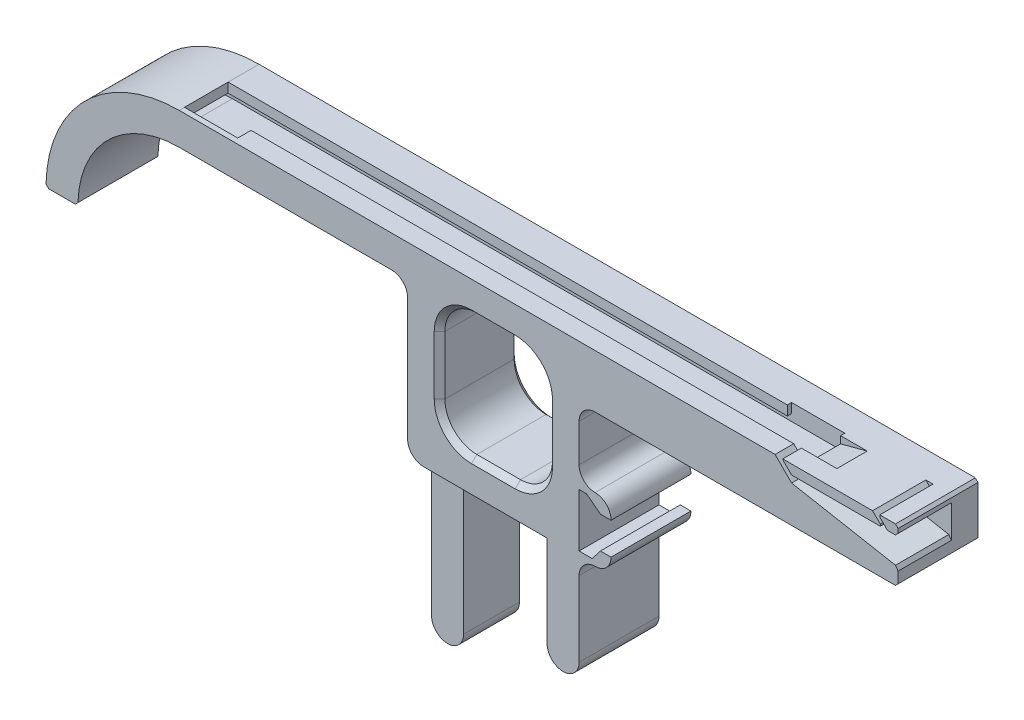
from build123d import *
from OCP.BRepFilletAPI import BRepFilletAPI_MakeChamfer

# Parameters (mm, degrees)
BOSS_EXTRUDE1_DEPTH = 15
BOSS_EXTRUDE2_DEPTH = 15
SKETCH6_W           = 115
SKETCH6_H           = 1.3
CUT_EXTRUDE2_DEPTH  = 10
CUT_EXTRUDE3_DEPTH  = 10
CUT_EXTRUDE4_DEPTH  = 10
BOSS_EXTRUDE3_DEPTH = 1
CUT_EXTRUDE5_REACH  = 117.913
SKETCH10_W          = 115
SKETCH10_H          = 5.7
SKETCH13_W          = 20.2
SKETCH13_H          = 23
CUT_EXTRUDE6_DEPTH  = 111.121977825
FILLET1_R           = 6
SKETCH14_W          = 6
SKETCH14_H          = 31
CUT_EXTRUDE7_DEPTH  = 4.5
FILLET2_R           = 3
SKETCH16_W          = 10
SKETCH16_H          = 2.5
CUT_EXTRUDE8_DEPTH  = 1.8
CHAMFER1_SIZE       = 0.5
CHAMFER1_SIZE_2     = 0.623907076
CHAMFER2_SIZE       = 1
CHAMFER3_SIZE       = 5
CHAMFER3_SIZE2      = 1.339745962
CUT_EXTRUDE12_REACH = 112.118
CHAMFER4_SIZE       = 0.2
CHAMFER4_SIZE_2     = 0.141421356
SKETCH25_W          = 6
SKETCH25_H          = 12
BOSS_EXTRUDE6_DEPTH = 15
FILLET4_START       = -1
FILLET4_DEPTH       = 16
FILLET4_2_DEPTH     = 15
CUT_EXTRUDE15_DEPTH = 15
CUT_EXTRUDE16_DEPTH = 10
CHAMFER5_SIZE       = 0.5
CHAMFER5_SIZE2      = 0.353553391
CHAMFER6_SIZE       = 0.65
SKETCH29_W          = 10
SKETCH29_H          = 0.8
CUT_EXTRUDE17_DEPTH = 3.1


with BuildPart() as part:
    # Sketch3 → Boss-Extrude1 (new body)
    with BuildSketch(Plane.XY):
        Polygon((0, 0), (0, 20.2), (-20.2, 20.2), (-20.2, -10.8), (-26.2, -10.8), (-26.2, 49.2), (-69.1, 49.2), (-69.1, 55.2), (5.9, 55.2), (65.9, 55.2), (65.9, 45.2), (6, 45.2), (6, 0), align=None)
    extrude(amount=BOSS_EXTRUDE1_DEPTH)

    # Sketch4 → Boss-Extrude2 (add)
    with BuildSketch(Plane.XY.offset(15)):
        with BuildLine():
            Line((-88.1, 30.2), (-94.1, 30.2))
            ThreePointArc((-94.1, 30.2), (-86.77766953, 47.87766953), (-69.1, 55.2))
            Line((-69.1, 55.2), (-69.1, 49.2))
            ThreePointArc((-69.1, 49.2), (-82.535028843, 43.635028843), (-88.1, 30.2))
        make_face()
    extrude(amount=-BOSS_EXTRUDE2_DEPTH)

    # Sketch6 → Cut-Extrude2 (cut)
    with BuildSketch(Plane.XY.offset(15)):
        with Locations((-11.6, 52.75)):
            Rectangle(SKETCH6_W, SKETCH6_H)
    extrude(amount=-CUT_EXTRUDE2_DEPTH, mode=Mode.SUBTRACT)

    # Sketch7 → Cut-Extrude3 (cut)
    with BuildSketch(Plane.XY.offset(15)):
        with BuildLine():
            Line((-92.3, 30.2), (-91, 30.2))
            ThreePointArc((-91, 30.2), (-84.585638508, 45.685638508), (-69.1, 52.1))
            Line((-69.1, 52.1), (-69.1, 53.4))
            ThreePointArc((-69.1, 53.4), (-85.504877324, 46.604877324), (-92.3, 30.2))
        make_face()
    extrude(amount=-CUT_EXTRUDE3_DEPTH, mode=Mode.SUBTRACT)

    # Sketch8 → Cut-Extrude4 (cut)
    with BuildSketch(Plane.XY.offset(15)):
        Polygon((45.9, 53.4), (65.9, 53.4), (65.9, 48.4), (45.9, 52.1), align=None)
    extrude(amount=-CUT_EXTRUDE4_DEPTH, mode=Mode.SUBTRACT)

    # Sketch9 → Boss-Extrude3 (add)
    with BuildSketch(Plane.XY.offset(15)):
        with BuildLine():
            Line((-69.1, 52.1), (45.9, 52.1))
            Line((45.9, 52.1), (45.9, 53.4))
            Line((45.9, 53.4), (-69.1, 53.4))
            ThreePointArc((-69.1, 53.4), (-85.504877324, 46.604877324), (-92.3, 30.2))
            Line((-92.3, 30.2), (-91, 30.2))
            ThreePointArc((-91, 30.2), (-84.585638508, 45.685638508), (-69.1, 52.1))
        make_face()
    extrude(amount=-BOSS_EXTRUDE3_DEPTH)

    # Cut-Extrude5: up to this face of the body (flat: up to its plane)
    cut_extrude5_end = Plane(part.part.faces().sort_by_distance((-11.6, 52.1, 9.5))[0])
    # Sketch10 → Cut-Extrude5 (cut, up to the picked face)
    with BuildSketch(Plane(origin=(0, 55.2, 0), x_dir=(-1, 0, 0), z_dir=(0, 1, 0)), mode=Mode.PRIVATE) as cut_extrude5_sk1:
        with Locations((11.6, 8.65)):
            Rectangle(SKETCH10_W, SKETCH10_H)
    cut_extrude5_tool1 = split(extrude(cut_extrude5_sk1.sketch, amount=-CUT_EXTRUDE5_REACH, mode=Mode.PRIVATE), bisect_by=cut_extrude5_end, keep=Keep.BOTH, mode=Mode.PRIVATE)
    add(cut_extrude5_tool1.solids().sort_by(Axis((-11.6, 55.2, 8.65), (0, -1, 0)))[0], mode=Mode.SUBTRACT)

    # Sketch13 → Cut-Extrude6 (cut, through all)
    with BuildSketch(Plane.XY.offset(15)):
        with Locations((-10.1, 37.7)):
            Rectangle(SKETCH13_W, SKETCH13_H)
    extrude(amount=-CUT_EXTRUDE6_DEPTH, mode=Mode.SUBTRACT)

    # Fillet1
    fillet1_edges = [part.edges().sort_by_distance(p)[0] for p in [
        (-20.2, 26.2, 7.5),
        (-20.2, 49.2, 7.5),
        (0, 49.2, 7.5),
        (0, 26.2, 7.5),
    ]]
    fillet(fillet1_edges, radius=FILLET1_R)

    # Sketch14 → Cut-Extrude7 (cut)
    with BuildSketch(Plane.XY.offset(15)):
        with Locations((-23.2, 4.7)):
            Rectangle(SKETCH14_W, SKETCH14_H)
    extrude(amount=-CUT_EXTRUDE7_DEPTH, mode=Mode.SUBTRACT)

    # Fillet2
    fillet2_edges = [part.edges().sort_by_distance(p)[0] for p in [
        (-26.2, 49.2, 7.5),
        (6, 45.2, 7.5),
        (-26.2, 20.2, 12.75),
        (6, 0, 7.5),
        (0, 0, 7.5),
        (-20.2, -10.8, 5.25),
        (-26.2, -10.8, 5.25),
    ]]
    fillet(fillet2_edges, radius=FILLET2_R - 0.0001)  # a hair under: the kernel refuses the full size

    # Sketch16 → Cut-Extrude8 (cut)
    with BuildSketch(Plane(origin=(0, 55.2, 0), x_dir=(-1, 0, 0), z_dir=(0, 1, 0))):
        with Locations((64.1, 12.75)):
            Rectangle(SKETCH16_W, SKETCH16_H)
    extrude(amount=-CUT_EXTRUDE8_DEPTH, mode=Mode.SUBTRACT)

    # Chamfer1
    # the kernel refuses this chamfer: 0.623907076, 0.5 mm, written as the material it takes off along each edge
    with BuildSketch(Plane(origin=(65.9, 55.2, -1.285841494), x_dir=(-1, 0, 0), z_dir=(0, 0, 1)), Plane(origin=(65.9, 45.2, -1.285841494), x_dir=(0, 1, 0), z_dir=(0, 0, 1))) as chamfer1_piece_1:
        Polygon((CHAMFER1_SIZE, 0), (0, CHAMFER1_SIZE), (0, 0), align=None)
    extrude(amount=17.571682988, mode=Mode.SUBTRACT)
    with BuildSketch(Plane(origin=(-88.1, 30.2, 16.303301327), x_dir=(-1, 0, 0), z_dir=(0, 0, -1))) as chamfer1_piece_2:
        with BuildLine():
            Line((CHAMFER1_SIZE, 0), (-0.006759226, 0.506759226))
            ThreePointArc((-0.006759226, 0.506759226), (-0.001786833, 0.26056951), (0, 0))
            Line((0, 0), (CHAMFER1_SIZE, 0))
        make_face()
    extrude(amount=17.606602654, mode=Mode.SUBTRACT)
    with BuildSketch(Plane(origin=(-94.1, 30.2, 16.285841494), x_dir=(1, 0, 0), z_dir=(0, 0, -1))) as chamfer1_piece_3:
        with BuildLine():
            Line((CHAMFER1_SIZE, 0), (0.004902903, -0.495097097))
            ThreePointArc((0.004902903, -0.495097097), (0.001296043, -0.254559377), (0, 0))
            Line((0, 0), (CHAMFER1_SIZE, 0))
        make_face()
    extrude(amount=17.571682988, mode=Mode.SUBTRACT)
    with BuildSketch(Plane(origin=(65.9, 53.4, 16.285841494), x_dir=(-1, 0, 0), z_dir=(0, 0, -1))) as chamfer1_piece_4:
        Polygon((CHAMFER1_SIZE, 0), (0, CHAMFER1_SIZE), (0, 0), align=None)
    extrude(amount=11.285841494, mode=Mode.SUBTRACT)
    with BuildSketch(Plane(origin=(65.9, 48.4, 16.611561789), x_dir=(-0.983314592491791, 0.18191319961097666, 0), z_dir=(0, 0, -1))) as chamfer1_piece_5:
        Polygon((CHAMFER1_SIZE, 0), (-CHAMFER1_SIZE_2 * 0.181913199708, -CHAMFER1_SIZE_2 * 0.983314593014), (0, 0), align=None)
    extrude(amount=11.611561789, mode=Mode.SUBTRACT)

    # Chamfer2
    chamfer2_edges = [part.edges().sort_by_distance(p)[0] for p in [
        (-10.1, 49.2, 15),
        (-10.1, 49.2, 0),
        (0, 37.7, 15),
        (0, 37.7, 0),
        (-10.1, 26.2, 15),
        (-10.1, 26.2, 0),
        (-20.2, 37.7, 15),
        (-20.2, 37.7, 0),
        (-1.757359313, 47.442640687, 15),
        (-1.757359313, 47.442640687, 0),
        (-1.757359313, 27.957359313, 15),
        (-1.757359313, 27.957359313, 0),
        (-18.442640687, 27.957359313, 15),
        (-18.442640687, 27.957359313, 0),
        (-18.442640687, 47.442640687, 15),
        (-18.442640687, 47.442640687, 0),
    ]]
    chamfer(chamfer2_edges, length=CHAMFER2_SIZE)

    # Chamfer3
    chamfer3_edges = [part.edges().sort_by_distance(p)[0] for p in [
        (45.9, 55.2, 8.65),
    ]]
    chamfer3_side = [part.faces().sort_by_distance(p)[0] for p in [
        (64.046661535, 55.2, 7.5),
    ]]
    chamfer(chamfer3_edges, length=CHAMFER3_SIZE, length2=CHAMFER3_SIZE2, reference=chamfer3_side[0])

    # Cut-Extrude12: up to this face of the body (flat: up to its plane)
    cut_extrude12_end = Plane(part.part.faces().sort_by_distance((-5.656799941, 54.307895333, 11.5))[0])
    # Sketch20 → Cut-Extrude12 (cut, up to the picked face)
    with BuildSketch(Plane.XY.offset(15), mode=Mode.PRIVATE) as cut_extrude12_sk1:
        Polygon((45.9, 52.1), (42.8, 55.2), (44.1, 55.2), (45.9, 53.4), align=None)
    cut_extrude12_tool1 = split(extrude(cut_extrude12_sk1.sketch, amount=-CUT_EXTRUDE12_REACH, mode=Mode.PRIVATE), bisect_by=cut_extrude12_end, keep=Keep.BOTH, mode=Mode.PRIVATE)
    add(cut_extrude12_tool1.solids().sort_by(Axis((44.646259, 53.946259, 15), (0, 0, -1)))[0], mode=Mode.SUBTRACT)

    # Chamfer4
    # the kernel refuses this chamfer: 0.2, 0.141421356 mm, written as the material it takes off along each edge
    with BuildSketch(Plane(origin=(44.6, 53.4, 10.985663402), x_dir=(-0.7071067811865653, 0.7071067811865298, 0), z_dir=(0, 0, 1))) as chamfer4_piece_1:
        Polygon((CHAMFER4_SIZE, 0), (CHAMFER4_SIZE_2 * 0.707106782373, CHAMFER4_SIZE_2 * 0.707106782373), (0, 0), align=None)
    extrude(amount=3.014336598, mode=Mode.SUBTRACT)
    with BuildSketch(Plane(origin=(44.1, 55.2, 15.514336598), x_dir=(1, 0, 0), z_dir=(0, 0, -1))) as chamfer4_piece_2:
        Polygon((CHAMFER4_SIZE_2 * 1.00000000168, 0), (CHAMFER4_SIZE * 0.707106781187, CHAMFER4_SIZE * 0.707106781186), (0, 0), align=None)
    extrude(amount=4.528673195, mode=Mode.SUBTRACT)

    # Sketch25 → Boss-Extrude6 (add)
    with BuildSketch(Plane.XY.offset(15)):
        with Locations((9, 26.1)):
            Rectangle(SKETCH25_W, SKETCH25_H)
    extrude(amount=-BOSS_EXTRUDE6_DEPTH)

    # Fillet4: read off the stored shape, not the designer's step
    # Fillet4 outline → Fillet4 (cut)
    with BuildSketch(Plane.XY.offset(FILLET4_START)):
        with BuildLine():
            ThreePointArc((9, 32.1), (11.121320344, 31.221320344), (12, 29.1))
            Line((12, 29.1), (12, 32.1))
            Line((12, 32.1), (9, 32.1))
        make_face()
        with BuildLine():
            ThreePointArc((12, 23.1), (11.121320344, 20.978679656), (9, 20.1))
            Line((9, 20.1), (12, 20.1))
            Line((12, 20.1), (12, 23.1))
        make_face()
    extrude(amount=FILLET4_DEPTH, mode=Mode.SUBTRACT)

    # Fillet4 2 outline → Fillet4 2 (add)
    with BuildSketch(Plane.XY):
        with BuildLine():
            Line((6, 32.1), (9, 32.1))
            ThreePointArc((9, 32.1), (6.878679656, 32.978679656), (6, 35.1))
            Line((6, 35.1), (6, 32.1))
        make_face()
        with BuildLine():
            ThreePointArc((6, 17.1), (6.878679656, 19.221320344), (9, 20.1))
            Line((9, 20.1), (6, 20.1))
            Line((6, 20.1), (6, 17.1))
        make_face()
    extrude(amount=FILLET4_2_DEPTH)

    # Sketch26 → Cut-Extrude15 (cut)
    with BuildSketch(Plane.XY.offset(15)):
        Polygon((12, 29.1), (10, 29.1), (7.402667467, 31.1), (6, 31.1), (6, 21.1), (8.459958458, 21.1), (10, 23.1), (12, 23.1), align=None)
    extrude(amount=-CUT_EXTRUDE15_DEPTH, mode=Mode.SUBTRACT)

    # Sketch27 → Cut-Extrude16 (cut)
    with BuildSketch(Plane.XY.offset(15)):
        Polygon((62.9, 53.4), (61.1, 55.2), (62.1, 55.2), (63.9, 53.4), align=None)
    extrude(amount=-CUT_EXTRUDE16_DEPTH, mode=Mode.SUBTRACT)

    # Chamfer5: one chamfer whose edges measure the first distance from different faces: ONE call of the kernel's chamfer builder (chamfer() names one face for all edges)
    chamfer5_edges_1 = [part.edges().sort_by_distance(p)[0] for p in [
        (62.9, 53.4, 10),
    ]]
    chamfer5_side_1 = [part.faces().sort_by_distance(p)[0] for p in [
        (62, 54.3, 10),
    ]]
    chamfer5_edges_2 = [part.edges().sort_by_distance(p)[0] for p in [
        (62.1, 55.2, 10),
    ]]
    chamfer5_side_2 = [part.faces().sort_by_distance(p)[0] for p in [
        (63, 54.3, 10),
    ]]
    chamfer5 = BRepFilletAPI_MakeChamfer(part.part.solid().wrapped)
    for e in chamfer5_edges_1:
        chamfer5.Add(CHAMFER5_SIZE, CHAMFER5_SIZE2, e.wrapped, chamfer5_side_1[0].wrapped)  # the first distance lies on this face
    for e in chamfer5_edges_2:
        chamfer5.Add(CHAMFER5_SIZE, CHAMFER5_SIZE2, e.wrapped, chamfer5_side_2[0].wrapped)  # the first distance lies on this face
    add(Compound.cast(chamfer5.Shape()), mode=Mode.REPLACE)

    # Chamfer6
    chamfer6_edges = [part.edges().sort_by_distance(p)[0] for p in [
        (-7.320710678, 53.4, 14),
        (-11.6, 52.1, 14),
        (-84.585638508, 45.685638508, 14),
        (-85.504877324, 46.604877324, 14),
    ]]
    chamfer(chamfer6_edges, length=CHAMFER6_SIZE - 0.0001)  # a hair under: the kernel refuses the full size

    # Sketch29 → Cut-Extrude17 (cut)
    with BuildSketch(Plane(origin=(0, 55.2, 0), x_dir=(-1, 0, 0), z_dir=(0, 1, 0))):
        with Locations((-40.9, 5.4)):
            Rectangle(SKETCH29_W, SKETCH29_H)
    extrude(amount=-CUT_EXTRUDE17_DEPTH, mode=Mode.SUBTRACT)


solid = part.part
